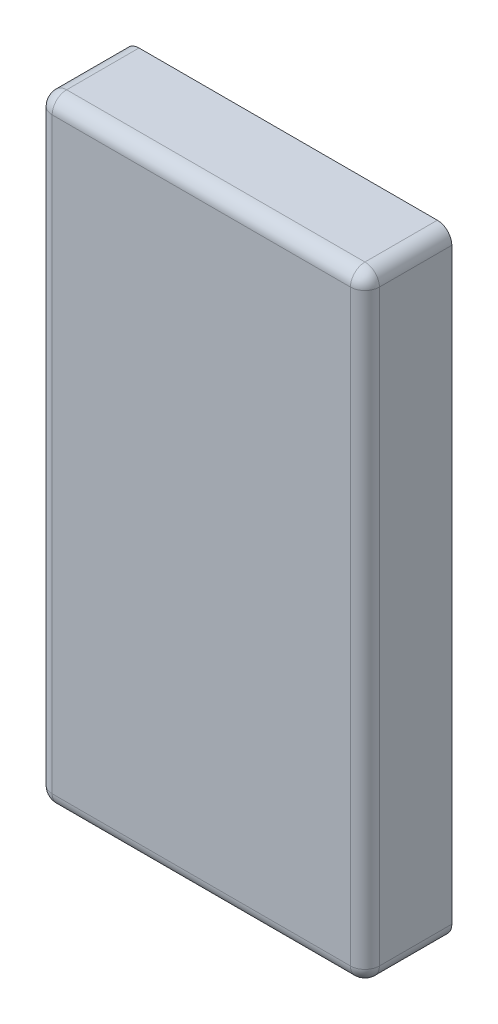
from build123d import *

# Parameters (mm, degrees)
ESBO_O1_W                = 22.6
ESBO_O1_H                = 42.6
RESSALTO_EXTRUS_O1_DEPTH = 6
ESBO_O2_W                = 8.25
ESBO_O2_H                = 8.25
ESBO_O2_W_2              = 4.25
ESBO_O2_H_2              = 4.25
RESSALTO_EXTRUS_O2_DEPTH = 3
FILETE1_R                = 1
FILETE2_R                = 1
ESBO_O3_R                = 2.5
CORTE_EXTRUS_O1_DEPTH    = 3


with BuildPart() as part:
    # Esboço1 → Ressalto-extrusão1 (new body)
    with BuildSketch(Plane.XY):
        Rectangle(ESBO_O1_W, ESBO_O1_H)
    extrude(amount=RESSALTO_EXTRUS_O1_DEPTH)

    # Esboço2 → Ressalto-extrusão2 (add)
    with BuildSketch(Plane(origin=(0, 0, 0), x_dir=(-1, 0, 0), z_dir=(0, 0, -1))):
        Rectangle(ESBO_O2_W, ESBO_O2_H)
        Rectangle(ESBO_O2_W_2, ESBO_O2_H_2, mode=Mode.SUBTRACT)
    extrude(amount=RESSALTO_EXTRUS_O2_DEPTH)

    # Filete1
    filete1_edges = [part.edges().sort_by_distance(p)[0] for p in [
        (0, -21.3, 6),
        (-11.3, 0, 6),
        (0, 21.3, 6),
        (11.3, 0, 6),
        (11.3, 21.3, 3),
        (-11.3, 21.3, 3),
        (11.3, -21.3, 3),
        (-11.3, -21.3, 3),
    ]]
    fillet(filete1_edges, radius=FILETE1_R)

    # Filete2
    filete2_edges = [part.edges().sort_by_distance(p)[0] for p in [
        (-4.125, 4.125, -1.5),
        (-4.125, -4.125, -1.5),
        (4.125, -4.125, -1.5),
        (4.125, 4.125, -1.5),
    ]]
    fillet(filete2_edges, radius=FILETE2_R)

    # Esboço3 → Corte-extrusão1 (cut)
    with BuildSketch(Plane(origin=(0, 0, 0), x_dir=(-1, 0, 0), z_dir=(0, 0, -1))):
        with Locations((0, 15)):
            Circle(ESBO_O3_R)
        with Locations((0, -15)):
            Circle(ESBO_O3_R)
    extrude(amount=-CORTE_EXTRUS_O1_DEPTH, mode=Mode.SUBTRACT)


solid = part.part
